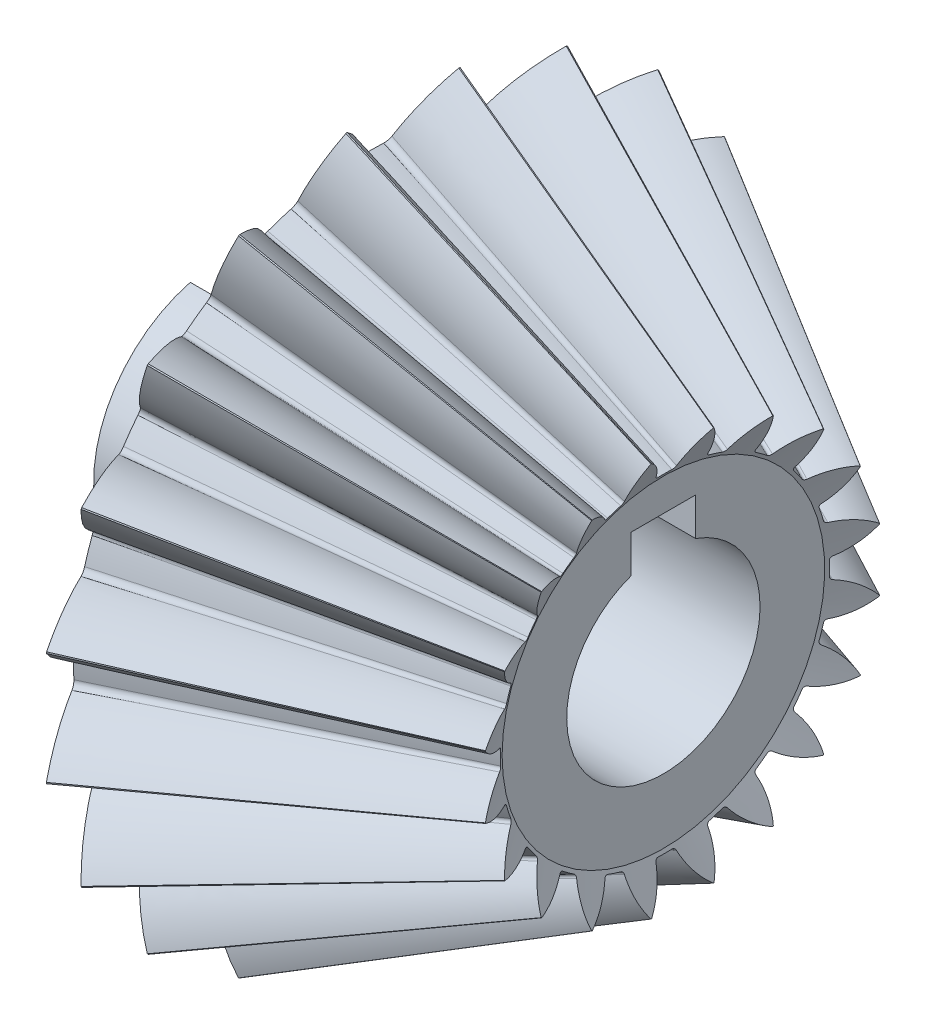
from build123d import *

# Parameters (mm, degrees)
TEETHCUTS_COUNT = 20
TEETHCUTS_ANGLE = 342
HUBSKE_R        = 4
HUB_DEPTH       = 4.528291257
BORSKE_R        = 3
BORE_DEPTH      = 25.0000508
KEYSKE_W        = 2
KEYSKE_H        = 4
KEYWAY_DEPTH    = 25.0000508


with BuildPart() as part:
    # BasProSke → Base-Revolve (revolve)
    with BuildSketch(Plane(origin=(0, 0, 0), x_dir=(1, 0, 0), z_dir=(0, 1, 0)), mode=Mode.PRIVATE) as base_revolve_sk:
        Polygon((0, 0), (0, 9.056379314), (1.07331263, 11.203004572), (9.748584537, 6.192868611), (9.155271908, 5.006243354), (9.155271908, 0), align=None)
    revolve(base_revolve_sk.sketch.rotate(Axis((-10, 0, 0), (1, 0, 0)), 180), axis=Axis((-10, 0, 0), (1, 0, 0)))

    # ToothCut: read off the stored shape, not the designer's step
    # ToothCut: loft between two sections, ruled curve by curve
    toothcut_from = [
        Edge.make_bspline([(20.475175686, 0.006730684, -0.010230454), (20.472620769, 0.00162085, -0.014432703), (20.469472441, -0.004675805, -0.01357417), (20.467444062, -0.008732563, -0.008122078)], [0, 0, 0, 0, 1, 1, 1, 1], 3, [1, 0.818595861, 0.818595861, 1]),
        Edge.make_bspline([(20.467444062, -0.008732563, 0.008122078), (20.469472441, -0.004675805, 0.01357417), (20.472620769, 0.00162085, 0.014432703), (20.475175686, 0.006730684, 0.010230454)], [0, 0, 0, 0, 1, 1, 1, 1], 3, [1, 0.818595861, 0.818595861, 1]),
        Edge.make_bspline([(20.467444062, -0.008732563, -0.008122078), (20.467124412, -0.009371863, -0.007262889), (20.466857955, -0.009904777, -0.006317325), (20.466649302, -0.010322084, -0.005301744)], [0, 0, 0, 0, 1, 1, 1, 1], 3, [1, 0.994233588, 0.994233588, 1]),
        Edge.make_bspline([(20.466649302, -0.010322084, 0.005301744), (20.466857955, -0.009904777, 0.006317325), (20.467124412, -0.009371863, 0.007262889), (20.467444062, -0.008732563, 0.008122078)], [0, 0, 0, 0, 1, 1, 1, 1], 3, [1, 0.994233588, 0.994233588, 1]),
        Edge.make_bspline([(20.466649302, -0.010322084, -0.005301744), (20.465946663, -0.011727361, -0.001881792), (20.465946663, -0.011727361, 0.001881792), (20.466649302, -0.010322084, 0.005301744)], [0, 0, 0, 0, 1, 1, 1, 1], 3, [1, 0.939130155, 0.939130155, 1]),
        Edge.make_line((20.475175686, 0.006730684, 0.010230454), (20.475175686, 0.006730684, -0.010230454)),
    ]
    toothcut_to = [
        Edge.make_bspline([(1.101068829, 11.258516969, -1.946212593), (0.857940224, 10.77225976, -1.2651625), (0.53110282, 10.118584953, -0.790532769), (0.153974829, 9.364328972, -0.570852964)], [0, 0, 0, 0, 1, 1, 1, 1], 3, [1, 0.965917598, 0.965917598, 1]),
        Edge.make_bspline([(0.153974829, 9.364328972, 0.570852964), (0.53110282, 10.118584953, 0.790532769), (0.857940224, 10.77225976, 1.2651625), (1.101068829, 11.258516969, 1.946212593)], [0, 0, 0, 0, 1, 1, 1, 1], 3, [1, 0.965917598, 0.965917598, 1]),
        Edge.make_bspline([(0.153974829, 9.364328972, -0.570852964), (0.113805435, 9.283990183, -0.547453999), (0.089108685, 9.234596684, -0.472849938), (0.090831971, 9.238043256, -0.380110711)], [0, 0, 0, 0, 1, 1, 1, 1], 3, [1, 0.852242502, 0.852242502, 1]),
        Edge.make_bspline([(0.090831971, 9.238043256, 0.380110711), (0.089108685, 9.234596684, 0.472849938), (0.113805435, 9.283990183, 0.547453999), (0.153974829, 9.364328972, 0.570852964)], [0, 0, 0, 0, 1, 1, 1, 1], 3, [1, 0.852242502, 0.852242502, 1]),
        Edge.make_bspline([(0.090831971, 9.238043256, -0.380110711), (0.095539445, 9.247458203, -0.126776434), (0.095539445, 9.247458203, 0.126776434), (0.090831971, 9.238043256, 0.380110711)], [0, 0, 0, 0, 1, 1, 1, 1], 3, [1, 0.999425256, 0.999425256, 1]),
        Edge.make_line((1.101068829, 11.258516969, 1.946212593), (1.101068829, 11.258516969, -1.946212593)),
    ]
    toothcut = Solid(Shell([*[Face.make_surface_from_curves(toothcut_from[k], toothcut_to[k]) for k in range(6)], Face(Wire(toothcut_from)), Face(Wire(toothcut_to))]))
    add(toothcut, mode=Mode.SUBTRACT)

    # TeethCuts: ToothCut ×20 about axis
    teethcuts_axis = Axis((-10, 0, 0), (1, 0, 0))
    for i in range(1, TEETHCUTS_COUNT):
        add(toothcut.rotate(teethcuts_axis, i * TEETHCUTS_ANGLE / (TEETHCUTS_COUNT - 1)), mode=Mode.SUBTRACT)

    # HubSke → Hub (add)
    with BuildSketch(Plane.ZY):
        with Locations(Location((0, 0, 0), (0, 0, 180))):
            Circle(HUBSKE_R)
    extrude(amount=HUB_DEPTH)

    # BorSke → Bore (cut, symmetric)
    with BuildSketch(Plane(origin=(0, 0, 0), x_dir=(0, 0, -1), z_dir=(1, 0, 0))):
        with Locations(Location((0, 0, 0), (0, 0, 180))):
            Circle(BORSKE_R)
    extrude(amount=BORE_DEPTH, both=True, mode=Mode.SUBTRACT)

    # KeySke → Keyway (cut, symmetric)
    with BuildSketch(Plane(origin=(0, 0, 0), x_dir=(0, 0, -1), z_dir=(1, 0, 0))):
        with Locations((0, 2)):
            Rectangle(KEYSKE_W, KEYSKE_H)
    extrude(amount=KEYWAY_DEPTH, both=True, mode=Mode.SUBTRACT)


solid = part.part
